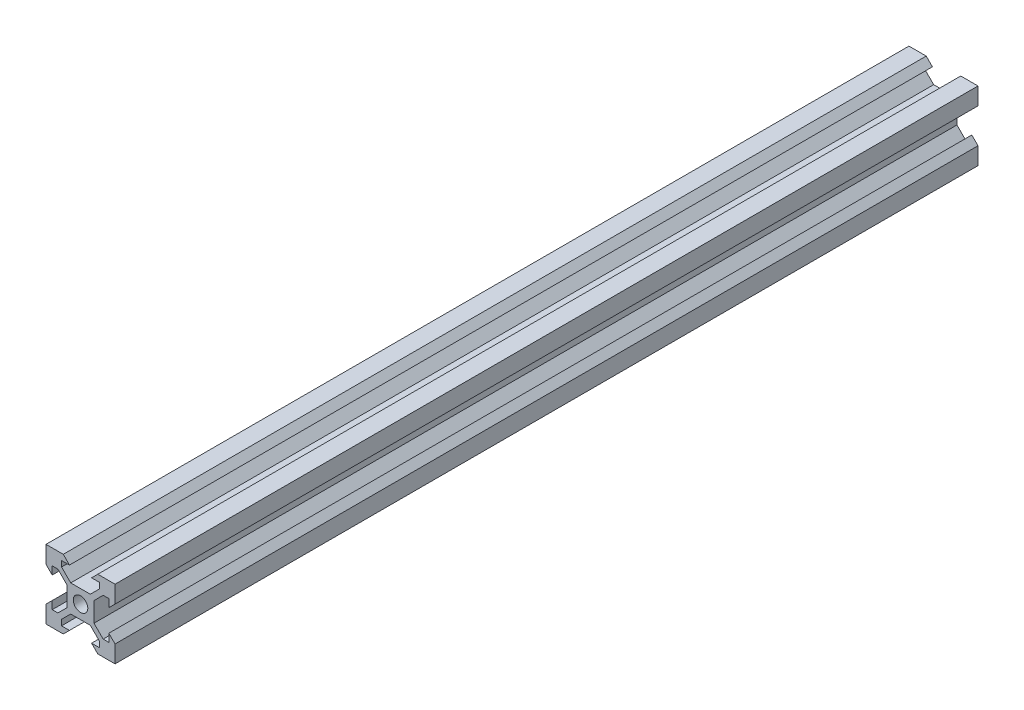
from build123d import *

# Parameters (mm, degrees)
SKETCH1_R           = 2.1
BOSS_EXTRUDE1_DEPTH = 125


with BuildPart() as part:
    # Sketch1 → Boss-Extrude1 (new, symmetric)
    with BuildSketch(Plane.XY):
        Polygon((-10, 10), (-5, 10), (-3.2, 8.2), (-5.499339828, 8.2), (-5.499339828, 6.56), (-2.84, 3.900660172), (2.84, 3.900660172), (5.499339828, 6.56), (5.499339828, 8.2), (3.2, 8.2), (5, 10), (10, 10), (10, 5), (8.2, 3.2), (8.2, 5.499339828), (6.56, 5.499339828), (3.900660172, 2.84), (3.900660172, -2.84), (6.56, -5.499339828), (8.2, -5.499339828), (8.2, -3.2), (10, -5), (10, -10), (5, -10), (3.2, -8.2), (5.499339828, -8.2), (5.499339828, -6.56), (2.84, -3.900660172), (-2.84, -3.900660172), (-5.499339828, -6.56), (-5.499339828, -8.2), (-3.2, -8.2), (-5, -10), (-10, -10), (-10, -5), (-8.2, -3.2), (-8.2, -5.499339828), (-6.56, -5.499339828), (-3.900660172, -2.84), (-3.900660172, 2.84), (-6.56, 5.499339828), (-8.2, 5.499339828), (-8.2, 3.2), (-10, 5), align=None)
        Circle(SKETCH1_R, mode=Mode.SUBTRACT)
    extrude(amount=BOSS_EXTRUDE1_DEPTH, both=True)


solid = part.part
